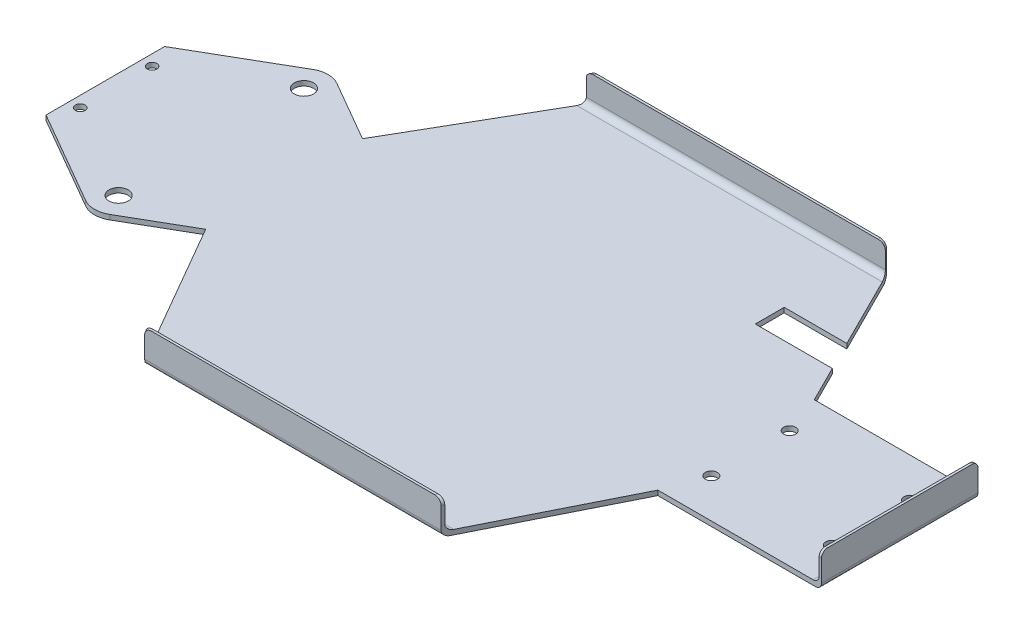
from build123d import *

# Parameters (mm, degrees)
SKETCH1_R           = 4
SKETCH1_R_2         = 2
SKETCH1_R_3         = 2.5
BOSS_EXTRUDE1_DEPTH = 2
SKETCH2_W           = 1
SKETCH2_H           = 65
BOSS_EXTRUDE2_DEPTH = 12
FILLET1_R           = 2.5


with BuildPart() as part:
    # Sketch1 → Boss-Extrude1 (new body)
    with BuildSketch(Plane(origin=(0, 0, 0), x_dir=(1, 0, 0), z_dir=(0, 1, 0))):
        with BuildLine():
            Line((165, -32.5), (165, 32.5))
            Line((165, 32.5), (97, 32.5))
            Line((97, 32.5), (89.5, 47.5))
            Line((89.5, 47.5), (57.5, 47.5))
            Line((57.5, 47.5), (57.5, 59.5))
            Line((57.5, 59.5), (83.5, 59.5))
            Line((83.5, 59.5), (67, 92.5))
            Line((67, 92.5), (-56.134697257, 92.5))
            Line((-56.134697257, 92.5), (-90.733708845, 32.572754038))
            Line((-90.733708845, 32.572754038), (-116, 47.160254038))
            ThreePointArc((-116, 47.160254038), (-121, 48.5), (-126, 47.160254038))
            Line((-126, 47.160254038), (-165, 24.643593539))
            Line((-165, 24.643593539), (-165, -24.643593539))
            Line((-165, -24.643593539), (-126, -47.160254038))
            ThreePointArc((-126, -47.160254038), (-121, -48.5), (-116, -47.160254038))
            Line((-116, -47.160254038), (-90.733708845, -32.572754038))
            Line((-90.733708845, -32.572754038), (-56.134697257, -92.5))
            Line((-56.134697257, -92.5), (67, -92.5))
            Line((67, -92.5), (97, -32.5))
            Line((97, -32.5), (165, -32.5))
        make_face()
        with Locations(Location((-121, -38.5, 0), (0, 0, 270))):
            Circle(SKETCH1_R, mode=Mode.SUBTRACT)
        with Locations(Location((-160.497563939, -14.92, 0), (0, 0, 270))):
            Circle(SKETCH1_R_2, mode=Mode.SUBTRACT)
        with Locations(Location((103, -16.25, 0), (0, 0, 270))):
            Circle(SKETCH1_R_3, mode=Mode.SUBTRACT)
        with Locations(Location((153, -16.25, 0), (0, 0, 270))):
            Circle(SKETCH1_R_3, mode=Mode.SUBTRACT)
        with Locations(Location((-160.497578586, 14.92, 0), (0, 0, 270))):
            Circle(SKETCH1_R_2, mode=Mode.SUBTRACT)
        with Locations(Location((-121, 38.5, 0), (0, 0, 270))):
            Circle(SKETCH1_R, mode=Mode.SUBTRACT)
        with Locations(Location((103, 16.25, 0), (0, 0, 270))):
            Circle(SKETCH1_R_3, mode=Mode.SUBTRACT)
        with Locations(Location((153, 16.25, 0), (0, 0, 270))):
            Circle(SKETCH1_R_3, mode=Mode.SUBTRACT)
    extrude(amount=BOSS_EXTRUDE1_DEPTH)

    # Sketch2 → Boss-Extrude2 (add)
    with BuildSketch(Plane(origin=(0, 2, 0), x_dir=(1, 0, 0), z_dir=(0, 1, 0))):
        Polygon((-56.134697257, -92.5), (67, -92.5), (67.5, -91.5), (-56.712047526, -91.5), align=None)
        Polygon((-56.134697257, 92.5), (67, 92.5), (67.5, 91.5), (-56.712047526, 91.5), align=None)
        with Locations((164.5, 0)):
            Rectangle(SKETCH2_W, SKETCH2_H)
    extrude(amount=BOSS_EXTRUDE2_DEPTH)

    # Fillet1
    # the kernel refuses this fillet: 2.5 mm, written as the material it adds along each edge
    with BuildSketch(Plane(origin=(73.75, 2, -91.5), x_dir=(0, 1, 0), z_dir=(-1, 0, 0))) as fillet1_piece_1_section:
        with BuildLine():
            CenterArc((FILLET1_R, -FILLET1_R), FILLET1_R, 90, 90)
            Line((0, -FILLET1_R), (0, 0))
            Line((0, 0), (FILLET1_R, 0))
        make_face()
    fillet1_piece_1 = extrude(amount=136.712047526, mode=Mode.PRIVATE)
    fillet1_piece_1 = split(fillet1_piece_1, bisect_by=Plane(origin=(-41.43720377, 2.56450665, -117.956805463), z_dir=(0.8660254037844399, 0, 0.49999999999999795)), keep=Keep.TOP, mode=Mode.PRIVATE)
    fillet1_piece_1 = split(fillet1_piece_1, bisect_by=Plane(origin=(55.3017959, 2.56450665, -115.8964082), z_dir=(-0.894427190999916, 0, 0.447213595499958)), keep=Keep.TOP, mode=Mode.PRIVATE)
    add(fillet1_piece_1)
    with BuildSketch(Plane(origin=(164, 2, 32.5), x_dir=(0, 1, 0), z_dir=(0, 0, -1))) as fillet1_piece_2:
        with BuildLine():
            CenterArc((FILLET1_R, -FILLET1_R), FILLET1_R, 90, 90)
            Line((0, -FILLET1_R), (0, 0))
            Line((0, 0), (FILLET1_R, 0))
        make_face()
    extrude(amount=65)
    with BuildSketch(Plane(origin=(73.75, 2, 91.5), x_dir=(0, 0, -1), z_dir=(-1, 0, 0))) as fillet1_piece_3_section:
        with BuildLine():
            CenterArc((FILLET1_R, -FILLET1_R), FILLET1_R, 90, 90)
            Line((0, -FILLET1_R), (0, 0))
            Line((0, 0), (FILLET1_R, 0))
        make_face()
    fillet1_piece_3 = extrude(amount=136.712047526, mode=Mode.PRIVATE)
    fillet1_piece_3 = split(fillet1_piece_3, bisect_by=Plane(origin=(55.3017959, 2.56450665, 115.8964082), z_dir=(-0.894427190999916, 0, -0.44721359549995787)), keep=Keep.TOP, mode=Mode.PRIVATE)
    fillet1_piece_3 = split(fillet1_piece_3, bisect_by=Plane(origin=(-41.43720377, 2.56450665, 117.956805463), z_dir=(0.8660254037844399, 0, -0.49999999999999795)), keep=Keep.TOP, mode=Mode.PRIVATE)
    add(fillet1_piece_3)
    # the kernel refuses this fillet: 2.5 mm, written as the material it takes off along each edge
    with BuildSketch(Plane(origin=(-59.837047526, 14, -86.087341226), x_dir=(0, -1, 0), z_dir=(0.5000000000000019, 0, -0.8660254037844376)), Plane(origin=(-59.837047526, 14, 86.087341226), x_dir=(0.8660254037844394, 0, -0.49999999999999867), z_dir=(0.4999999999999987, 0, 0.8660254037844395))) as fillet1_2_piece_1:
        with BuildLine():
            CenterArc((FILLET1_R, -FILLET1_R), FILLET1_R, 90, 90)
            Line((0, -FILLET1_R), (0, 0))
            Line((0, 0), (FILLET1_R, 0))
        make_face()
    extrude(amount=13.654700538, mode=Mode.SUBTRACT)
    with BuildSketch(Plane(origin=(64.204915028, 14, -98.090169944), x_dir=(0, -1, 0), z_dir=(0.447213595499958, 0, 0.894427190999916))) as fillet1_2_piece_2:
        with BuildLine():
            CenterArc((FILLET1_R, -FILLET1_R), FILLET1_R, 90, 90)
            Line((0, -FILLET1_R), (0, 0))
            Line((0, 0), (FILLET1_R, 0))
        make_face()
    extrude(amount=13.618033989, mode=Mode.SUBTRACT)
    with BuildSketch(Plane(origin=(157.75, 14, -32.5), x_dir=(0, -1, 0), z_dir=(1, 0, 0)), Plane(origin=(171.25, 14, 32.5), x_dir=(0, -1, 0), z_dir=(-1, 0, 0))) as fillet1_2_piece_3:
        with BuildLine():
            CenterArc((FILLET1_R, -FILLET1_R), FILLET1_R, 90, 90)
            Line((0, -FILLET1_R), (0, 0))
            Line((0, 0), (FILLET1_R, 0))
        make_face()
    extrude(amount=13.5, mode=Mode.SUBTRACT)
    with BuildSketch(Plane(origin=(73.25, 0, -92.5), x_dir=(0, 0, 1), z_dir=(-1, 0, 0))) as fillet1_2_piece_4:
        with BuildLine():
            CenterArc((FILLET1_R, FILLET1_R), FILLET1_R, 180, 90)
            Line((0, FILLET1_R), (0, 0))
            Line((0, 0), (FILLET1_R, 0))
        make_face()
    extrude(amount=135.634697257, mode=Mode.SUBTRACT)
    with BuildSketch(Plane(origin=(165, 0, 38.75), x_dir=(-1, 0, 0), z_dir=(0, 0, -1))) as fillet1_2_piece_5:
        with BuildLine():
            CenterArc((FILLET1_R, FILLET1_R), FILLET1_R, 180, 90)
            Line((0, FILLET1_R), (0, 0))
            Line((0, 0), (FILLET1_R, 0))
        make_face()
    extrude(amount=77.5, mode=Mode.SUBTRACT)
    with BuildSketch(Plane(origin=(-62.384697257, 0, 92.5), x_dir=(0, 1, 0), z_dir=(1, 0, 0))) as fillet1_2_piece_6:
        with BuildLine():
            CenterArc((FILLET1_R, -FILLET1_R), FILLET1_R, 90, 90)
            Line((0, -FILLET1_R), (0, 0))
            Line((0, 0), (FILLET1_R, 0))
        make_face()
    extrude(amount=135.634697257, mode=Mode.SUBTRACT)
    with BuildSketch(Plane(origin=(64.204915028, 14, 98.090169944), x_dir=(0, -1, 0), z_dir=(0.447213595499958, 0, -0.894427190999916))) as fillet1_2_piece_7:
        with BuildLine():
            CenterArc((FILLET1_R, FILLET1_R), FILLET1_R, 180, 90)
            Line((0, FILLET1_R), (0, 0))
            Line((0, 0), (FILLET1_R, 0))
        make_face()
    extrude(amount=13.618033989, mode=Mode.SUBTRACT)


solid = part.part
